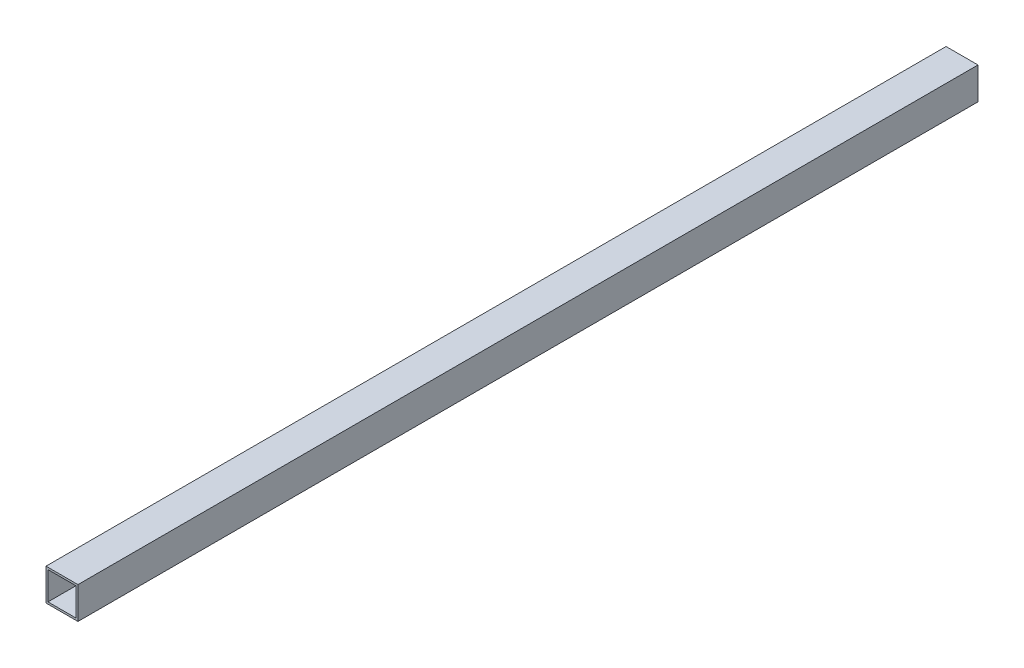
from build123d import *

# Parameters (mm, degrees)
SKETCH1_W           = 25.4
SKETCH1_H           = 25.4
SKETCH1_W_2         = 22.225
SKETCH1_H_2         = 22.225
BOSS_EXTRUDE1_DEPTH = 357.759


with BuildPart() as part:
    # Sketch1 → Boss-Extrude1 (new, symmetric)
    with BuildSketch(Plane.XY):
        Rectangle(SKETCH1_W, SKETCH1_H)
        Rectangle(SKETCH1_W_2, SKETCH1_H_2, mode=Mode.SUBTRACT)
    extrude(amount=BOSS_EXTRUDE1_DEPTH, both=True)


solid = part.part
